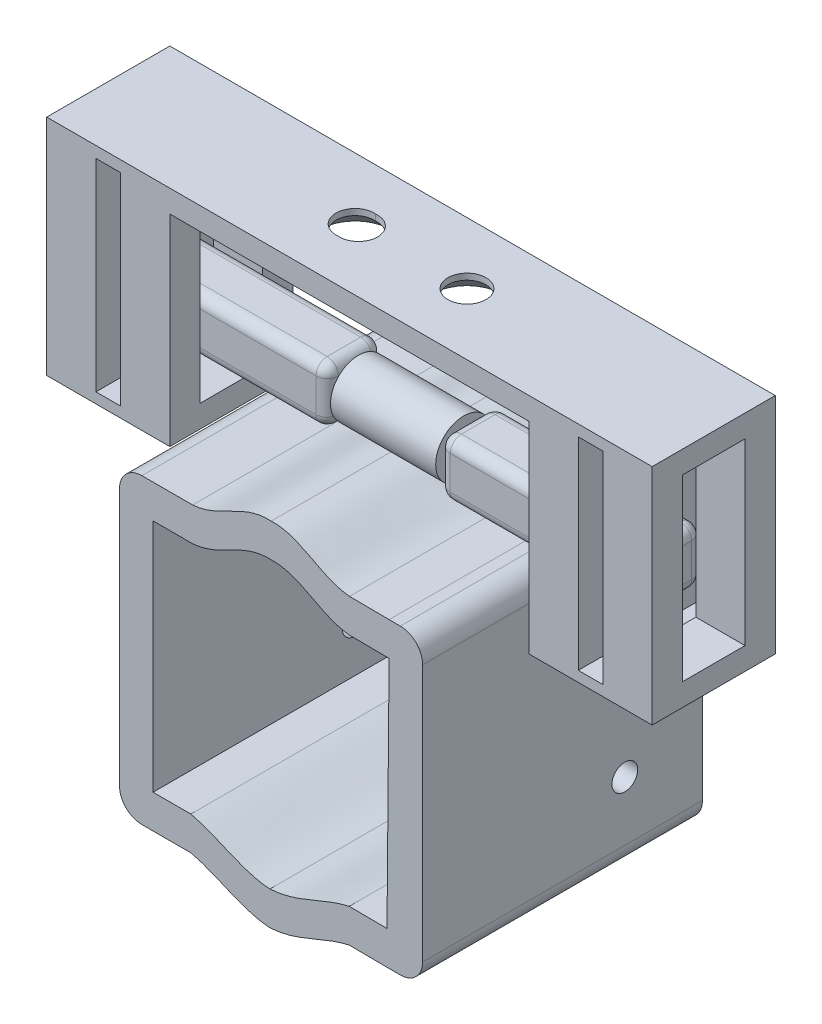
from build123d import *

# Parameters (mm, degrees)
EXTRUDE_1_DEPTH             = 25
CUT_EXTRUDE_1_DEPTH         = 41.095876517
CUT_EXTRUDE_1_DEPTH_BACK    = 41.095876517
SKETCH_2_R                  = 1.15
EXTRUDE_2_DEPTH             = 2.5
EXTRUDE_2_2_DEPTH           = 2.5
SKETCH_5_4_ONE_SIDE_W       = 10
SKETCH_5_4_ONE_SIDE_H       = 1.2
REVOLVE_START               = -4.643273261
REVOLVE_2_OUTLINE_R         = 2.5
REVOLVE_2_OUTLINE_R_2       = 1.5
REVOLVE_2_DEPTH             = 9.4
FILLET_2_R                  = 2
EXTRUDE_4_DEPTH             = 3
EXTRUDE_5_DEPTH             = 8
CUT_EXTRUDE_2_DEPTH         = 64.532099048
CUT_EXTRUDE_2_DEPTH_BACK    = 64.532099048
SKETCH_8_W                  = 5.6
SKETCH_8_H                  = 16
CUT_EXTRUDE_3_DEPTH         = 47.413569012
CUT_EXTRUDE_3_DEPTH_BACK    = 47.413569012
SKETCH_9_W                  = 2.2
SKETCH_9_H                  = 18.065509992
CUT_EXTRUDE_4_DEPTH         = 46.334527546
CUT_EXTRUDE_4_DEPTH_BACK    = 46.334527546
SKETCH_10_R                 = 1.1
EXTRUDE_6_REACH             = 63.183
FILLET_3_R                  = 1
HOLE_WIZARD_M3_1_AT_2_COUNT = 2
HOLE_WIZARD_M3_1_AT_2_PITCH = 10
HOLE_WIZARD_M3_1_AT_3_COUNT = 2
HOLE_WIZARD_M3_1_AT_3_PITCH = 0.306726739


# Read off the part's stored shape, not the designer's step: 旋转2
with BuildPart() as part:
    # 草图1 → 凸台-拉伸1 (new body)
    with BuildSketch(Plane.XY):
        with BuildLine():
            Line((7.052697147, 13.436823414), (10.592794585, 13.405158827))
            Line((10.592794585, 13.405158827), (13.592794585, 13.405158827))
            Line((13.592794585, 13.405158827), (13.592794585, -13.592980697))
            Line((13.592794585, -13.592980697), (10.404975627, -13.592980697))
            Line((10.404975627, -13.592980697), (7.029904788, -13.562792199))
            add(Edge.make_bspline(
                [(7.029904788, -13.562792199), (4.597333526, -14.096242424), (2.501456168, -15.632148645), (-0.057443029, -15.766813933)],
                knots=[0, 0, 0, 0, 1, 1, 1, 1], degree=3))
            add(Edge.make_bspline(
                [(-7.124794153, -13.499489743), (-4.697091476, -14.05467602), (-2.615035398, -15.60926674), (-0.057443029, -15.766813933)],
                knots=[0, 0, 0, 0, 1, 1, 1, 1], degree=3))
            Line((-7.124794153, -13.499489743), (-10.5, -13.499489743))
            Line((-10.5, -13.499489743), (-13.5, -13.499489743))
            Line((-13.5, -13.499489743), (-13.5, -10.499489743))
            Line((-13.5, -10.499489743), (-13.5, 10.499489743))
            Line((-13.5, 10.499489743), (-13.5, 13.499489743))
            Line((-13.5, 13.499489743), (-10.5, 13.499489743))
            Line((-10.5, 13.499489743), (-6.959760952, 13.499489743))
            add(Edge.make_bspline(
                [(-6.959760952, 13.499489743), (-4.398436956, 13.674500845), (-2.600498048, 15.908759419), (0.056726739, 15.762032629)],
                knots=[0, 0, 0, 0, 1, 1, 1, 1], degree=3))
            add(Edge.make_bspline(
                [(7.052697147, 13.436823414), (4.493040937, 13.634736496), (2.71515759, 15.884986815), (0.056726739, 15.762032629)],
                knots=[0, 0, 0, 0, 1, 1, 1, 1], degree=3))
        make_face()
        with BuildLine():
            Line((-6.959760952, 10.499489743), (-10.5, 10.499489743))
            Line((-10.5, 10.499489743), (-10.5, -10.499489743))
            Line((-10.5, -10.499489743), (-7.124794153, -10.499489743))
            add(Edge.make_bspline(
                [(-7.124794153, -10.499489743), (-4.697091476, -11.05467602), (-2.615035398, -12.60926674), (-0.057443029, -12.766813933)],
                knots=[0, 0, 0, 0, 1, 1, 1, 1], degree=3))
            add(Edge.make_bspline(
                [(7.029904788, -10.562792199), (4.597333526, -11.096242424), (2.501456168, -12.632148645), (-0.057443029, -12.766813933)],
                knots=[0, 0, 0, 0, 1, 1, 1, 1], degree=3))
            Line((7.029904788, -10.562792199), (10.404975627, -10.592980697))
            Line((10.404975627, -10.592980697), (10.592794585, 10.405158827))
            Line((10.592794585, 10.405158827), (7.052697147, 10.436823414))
            add(Edge.make_bspline(
                [(7.052697147, 10.436823414), (4.493040937, 10.634736496), (2.71515759, 12.884986815), (0.056726739, 12.762032629)],
                knots=[0, 0, 0, 0, 1, 1, 1, 1], degree=3))
            add(Edge.make_bspline(
                [(-6.959760952, 10.499489743), (-4.398436956, 10.674500845), (-2.600498048, 12.908759419), (0.056726739, 12.762032629)],
                knots=[0, 0, 0, 0, 1, 1, 1, 1], degree=3))
        make_face(mode=Mode.SUBTRACT)
    extrude(amount=EXTRUDE_1_DEPTH)

    # 草图2 → 切除-拉伸1 (cut, two sides: drawn at the far end of the back side and taken through both)
    with BuildSketch(Plane(origin=(13.592794585, 0, 0), x_dir=(0, 0, -1), z_dir=(1, 0, 0)).offset(-CUT_EXTRUDE_1_DEPTH_BACK)):
        with Locations(Location((-6.94, 9.695158827, 0), (0, 0, 38.125882952))):
            Circle(SKETCH_2_R)
        with Locations(Location((-6.94, -6.304841173, 0), (0, 0, 90))):
            Circle(SKETCH_2_R)
    extrude(amount=CUT_EXTRUDE_1_DEPTH + CUT_EXTRUDE_1_DEPTH_BACK, mode=Mode.SUBTRACT)

    # 圆角2
    fillet_2_edges = [part.edges().sort_by_distance(p)[0] for p in [
        (13.592794585, 13.405158827, 12.5),
        (13.592794585, -13.592980697, 12.5),
        (-13.5, -13.499489743, 12.5),
        (-13.5, 13.499489743, 12.5),
    ]]
    fillet(fillet_2_edges, radius=FILLET_2_R)


with BuildPart() as body_2:
    # 草图5 → 凸台-拉伸2 (new, symmetric)
    with BuildSketch(Plane(origin=(0, 17.499489743, 0), x_dir=(1, 0, 0), z_dir=(0, 1, 0))):
        Polygon((5.056726739, -14), (5.056726739, -15), (23.613453479, -15), (23.613453479, -10), (5.056726739, -10), (5.056726739, -11), (5.056726739, -11.3), (5.056726739, -12.5), align=None)
    extrude(amount=EXTRUDE_2_DEPTH, both=True)



with BuildPart() as body_3:
    # 草图5 → Extrude 2 2 (new, symmetric)
    with BuildSketch(Plane(origin=(0, 17.499489743, 0), x_dir=(1, 0, 0), z_dir=(0, 1, 0))):
        Polygon((-4.943273261, -10), (-23.5, -10), (-23.5, -15), (-4.943273261, -15), (-4.943273261, -14), (-4.943273261, -12.5), (-4.943273261, -11.3), (-4.943273261, -11), align=None)
    extrude(amount=EXTRUDE_2_2_DEPTH, both=True)


with BuildPart() as body_2_1:
    add(body_2.part)

    add(body_3.part)  # 旋转1 merges body 3
    # 草图5<4> one side → 旋转1 (revolve)
    with BuildSketch(Plane(origin=(0, 17.499489743, 0), x_dir=(1, 0, 0), z_dir=(0, 1, 0)), mode=Mode.PRIVATE) as revolve_1_sk:
        with Locations((0.056726739, -11.9)):
            Rectangle(SKETCH_5_4_ONE_SIDE_W, SKETCH_5_4_ONE_SIDE_H)
    revolve(revolve_1_sk.sketch.rotate(Axis((-4.943273261, 17.499489743, 12.5), (1, 0, 0)), 180), axis=Axis((-4.943273261, 17.499489743, 12.5), (1, 0, 0)))

    # 草图10 → 切除-拉伸4 (cut, two sides: drawn at the far end of the back side and taken through both)
    with BuildSketch(Plane(origin=(0, 0, 10), x_dir=(-1, 0, 0), z_dir=(0, 0, -1)).offset(-CUT_EXTRUDE_4_DEPTH_BACK)):
        with Locations((21.5, 17.499489743)):
            Circle(SKETCH_10_R)
        with Locations((-21.613453479, 17.499489743)):
            Circle(SKETCH_10_R)
    extrude(amount=CUT_EXTRUDE_4_DEPTH + CUT_EXTRUDE_4_DEPTH_BACK, mode=Mode.SUBTRACT)

    # 圆角3
    # the kernel refuses this fillet: 1 mm, written as the material it takes off along each edge
    with BuildSketch(Plane(origin=(-5.943273261, 18.999489743, 11), x_dir=(1, 0, 0), z_dir=(0, 0, -1))) as fillet_3_piece_1_section:
        Polygon((0, 0), (FILLET_3_R, 0), (FILLET_3_R, -FILLET_3_R), (0, -FILLET_3_R), align=None)
    fillet_3_piece_1 = extrude(amount=FILLET_3_R, mode=Mode.PRIVATE)
    fillet_3_piece_1 = fillet_3_piece_1 - Plane(origin=(-5.943273261, 18.999489743, 11), x_dir=(-0.7071067811865475, -0.7071067811865475, 0), z_dir=(0, 0, -1)) * Sphere(FILLET_3_R, mode=Mode.PRIVATE)
    add(fillet_3_piece_1, mode=Mode.SUBTRACT)
    with BuildSketch(Plane(origin=(-22.5, 18.999489743, 11), x_dir=(-1, 0, 0), z_dir=(0, 0, -1))) as fillet_3_piece_2_section:
        Polygon((0, 0), (FILLET_3_R, 0), (FILLET_3_R, FILLET_3_R), (0, FILLET_3_R), align=None)
    fillet_3_piece_2 = extrude(amount=FILLET_3_R, mode=Mode.PRIVATE)
    fillet_3_piece_2 = fillet_3_piece_2 - Plane(origin=(-22.5, 18.999489743, 11), x_dir=(0.7071067811865475, -0.7071067811865475, 0), z_dir=(0, 0, -1)) * Sphere(FILLET_3_R, mode=Mode.PRIVATE)
    add(fillet_3_piece_2, mode=Mode.SUBTRACT)
    with BuildSketch(Plane(origin=(-22.5, 18.999489743, 14), x_dir=(0, 1, 0), z_dir=(-1, 0, 0))) as fillet_3_piece_3_section:
        Polygon((0, 0), (FILLET_3_R, 0), (FILLET_3_R, -FILLET_3_R), (0, -FILLET_3_R), align=None)
    fillet_3_piece_3 = extrude(amount=FILLET_3_R, mode=Mode.PRIVATE)
    fillet_3_piece_3 = fillet_3_piece_3 - Plane(origin=(-22.5, 18.999489743, 14), x_dir=(0, -0.7071067811865475, -0.7071067811865475), z_dir=(-1, 0, 0)) * Sphere(FILLET_3_R, mode=Mode.PRIVATE)
    add(fillet_3_piece_3, mode=Mode.SUBTRACT)
    with BuildSketch(Plane(origin=(22.613453479, 18.999489743, 11), x_dir=(0, 0, -1), z_dir=(0, 1, 0))) as fillet_3_piece_4_section:
        Polygon((0, 0), (FILLET_3_R, 0), (FILLET_3_R, -FILLET_3_R), (0, -FILLET_3_R), align=None)
    fillet_3_piece_4 = extrude(amount=FILLET_3_R, mode=Mode.PRIVATE)
    fillet_3_piece_4 = fillet_3_piece_4 - Plane(origin=(22.613453479, 18.999489743, 11), x_dir=(-0.7071067811865475, 0, 0.7071067811865475), z_dir=(0, 1, 0)) * Sphere(FILLET_3_R, mode=Mode.PRIVATE)
    add(fillet_3_piece_4, mode=Mode.SUBTRACT)
    with BuildSketch(Plane(origin=(6.056726739, 18.999489743, 11), x_dir=(0, 1, 0), z_dir=(-1, 0, 0))) as fillet_3_piece_5_section:
        Polygon((0, 0), (FILLET_3_R, 0), (FILLET_3_R, FILLET_3_R), (0, FILLET_3_R), align=None)
    fillet_3_piece_5 = extrude(amount=FILLET_3_R, mode=Mode.PRIVATE)
    fillet_3_piece_5 = fillet_3_piece_5 - Plane(origin=(6.056726739, 18.999489743, 11), x_dir=(0, -0.7071067811865475, 0.7071067811865475), z_dir=(-1, 0, 0)) * Sphere(FILLET_3_R, mode=Mode.PRIVATE)
    add(fillet_3_piece_5, mode=Mode.SUBTRACT)
    with BuildSketch(Plane(origin=(22.613453479, 15.999489743, 11), x_dir=(0, 0, -1), z_dir=(0, -1, 0))) as fillet_3_piece_6_section:
        Polygon((0, 0), (FILLET_3_R, 0), (FILLET_3_R, FILLET_3_R), (0, FILLET_3_R), align=None)
    fillet_3_piece_6 = extrude(amount=FILLET_3_R, mode=Mode.PRIVATE)
    fillet_3_piece_6 = fillet_3_piece_6 - Plane(origin=(22.613453479, 15.999489743, 11), x_dir=(-0.7071067811865475, 0, 0.7071067811865475), z_dir=(0, -1, 0)) * Sphere(FILLET_3_R, mode=Mode.PRIVATE)
    add(fillet_3_piece_6, mode=Mode.SUBTRACT)
    with BuildSketch(Plane(origin=(6.056726739, 15.999489743, 11), x_dir=(0, -1, 0), z_dir=(-1, 0, 0))) as fillet_3_piece_7_section:
        Polygon((0, 0), (FILLET_3_R, 0), (FILLET_3_R, -FILLET_3_R), (0, -FILLET_3_R), align=None)
    fillet_3_piece_7 = extrude(amount=FILLET_3_R, mode=Mode.PRIVATE)
    fillet_3_piece_7 = fillet_3_piece_7 - Plane(origin=(6.056726739, 15.999489743, 11), x_dir=(0, 0.7071067811865475, 0.7071067811865475), z_dir=(-1, 0, 0)) * Sphere(FILLET_3_R, mode=Mode.PRIVATE)
    add(fillet_3_piece_7, mode=Mode.SUBTRACT)
    with BuildSketch(Plane(origin=(6.056726739, 15.999489743, 14), x_dir=(0, 0, 1), z_dir=(-1, 0, 0))) as fillet_3_piece_8_section:
        Polygon((0, 0), (FILLET_3_R, 0), (FILLET_3_R, -FILLET_3_R), (0, -FILLET_3_R), align=None)
    fillet_3_piece_8 = extrude(amount=FILLET_3_R, mode=Mode.PRIVATE)
    fillet_3_piece_8 = fillet_3_piece_8 - Plane(origin=(6.056726739, 15.999489743, 14), x_dir=(0, 0.7071067811865475, -0.7071067811865475), z_dir=(-1, 0, 0)) * Sphere(FILLET_3_R, mode=Mode.PRIVATE)
    add(fillet_3_piece_8, mode=Mode.SUBTRACT)
    with BuildSketch(Plane(origin=(22.613453479, 15.999489743, 14), x_dir=(0, -1, 0), z_dir=(0, 0, 1))) as fillet_3_piece_9_section:
        Polygon((0, 0), (FILLET_3_R, 0), (FILLET_3_R, FILLET_3_R), (0, FILLET_3_R), align=None)
    fillet_3_piece_9 = extrude(amount=FILLET_3_R, mode=Mode.PRIVATE)
    fillet_3_piece_9 = fillet_3_piece_9 - Plane(origin=(22.613453479, 15.999489743, 14), x_dir=(-0.7071067811865475, 0.7071067811865475, 0), z_dir=(0, 0, 1)) * Sphere(FILLET_3_R, mode=Mode.PRIVATE)
    add(fillet_3_piece_9, mode=Mode.SUBTRACT)
    with BuildSketch(Plane(origin=(6.056726739, 18.999489743, 14), x_dir=(0, 0, 1), z_dir=(-1, 0, 0))) as fillet_3_piece_10_section:
        Polygon((0, 0), (FILLET_3_R, 0), (FILLET_3_R, FILLET_3_R), (0, FILLET_3_R), align=None)
    fillet_3_piece_10 = extrude(amount=FILLET_3_R, mode=Mode.PRIVATE)
    fillet_3_piece_10 = fillet_3_piece_10 - Plane(origin=(6.056726739, 18.999489743, 14), x_dir=(0, -0.7071067811865475, -0.7071067811865475), z_dir=(-1, 0, 0)) * Sphere(FILLET_3_R, mode=Mode.PRIVATE)
    add(fillet_3_piece_10, mode=Mode.SUBTRACT)
    with BuildSketch(Plane(origin=(22.613453479, 18.999489743, 14), x_dir=(0, 1, 0), z_dir=(0, 0, 1))) as fillet_3_piece_11_section:
        Polygon((0, 0), (FILLET_3_R, 0), (FILLET_3_R, -FILLET_3_R), (0, -FILLET_3_R), align=None)
    fillet_3_piece_11 = extrude(amount=FILLET_3_R, mode=Mode.PRIVATE)
    fillet_3_piece_11 = fillet_3_piece_11 - Plane(origin=(22.613453479, 18.999489743, 14), x_dir=(-0.7071067811865475, -0.7071067811865475, 0), z_dir=(0, 0, 1)) * Sphere(FILLET_3_R, mode=Mode.PRIVATE)
    add(fillet_3_piece_11, mode=Mode.SUBTRACT)
    with BuildSketch(Plane(origin=(-5.943273261, 18.999489743, 14), x_dir=(0, 1, 0), z_dir=(1, 0, 0))) as fillet_3_piece_12_section:
        Polygon((0, 0), (FILLET_3_R, 0), (FILLET_3_R, FILLET_3_R), (0, FILLET_3_R), align=None)
    fillet_3_piece_12 = extrude(amount=FILLET_3_R, mode=Mode.PRIVATE)
    fillet_3_piece_12 = fillet_3_piece_12 - Plane(origin=(-5.943273261, 18.999489743, 14), x_dir=(0, -0.7071067811865475, -0.7071067811865475), z_dir=(1, 0, 0)) * Sphere(FILLET_3_R, mode=Mode.PRIVATE)
    add(fillet_3_piece_12, mode=Mode.SUBTRACT)
    with BuildSketch(Plane(origin=(-22.5, 15.999489743, 14), x_dir=(-1, 0, 0), z_dir=(0, -1, 0))) as fillet_3_piece_13_section:
        Polygon((0, 0), (FILLET_3_R, 0), (FILLET_3_R, -FILLET_3_R), (0, -FILLET_3_R), align=None)
    fillet_3_piece_13 = extrude(amount=FILLET_3_R, mode=Mode.PRIVATE)
    fillet_3_piece_13 = fillet_3_piece_13 - Plane(origin=(-22.5, 15.999489743, 14), x_dir=(0.7071067811865475, 0, -0.7071067811865475), z_dir=(0, -1, 0)) * Sphere(FILLET_3_R, mode=Mode.PRIVATE)
    add(fillet_3_piece_13, mode=Mode.SUBTRACT)
    with BuildSketch(Plane(origin=(-5.943273261, 15.999489743, 14), x_dir=(1, 0, 0), z_dir=(0, -1, 0))) as fillet_3_piece_14_section:
        Polygon((0, 0), (FILLET_3_R, 0), (FILLET_3_R, FILLET_3_R), (0, FILLET_3_R), align=None)
    fillet_3_piece_14 = extrude(amount=FILLET_3_R, mode=Mode.PRIVATE)
    fillet_3_piece_14 = fillet_3_piece_14 - Plane(origin=(-5.943273261, 15.999489743, 14), x_dir=(-0.7071067811865475, 0, -0.7071067811865475), z_dir=(0, -1, 0)) * Sphere(FILLET_3_R, mode=Mode.PRIVATE)
    add(fillet_3_piece_14, mode=Mode.SUBTRACT)
    with BuildSketch(Plane(origin=(-22.5, 15.999489743, 11), x_dir=(0, -1, 0), z_dir=(0, 0, -1))) as fillet_3_piece_15_section:
        Polygon((0, 0), (FILLET_3_R, 0), (FILLET_3_R, FILLET_3_R), (0, FILLET_3_R), align=None)
    fillet_3_piece_15 = extrude(amount=FILLET_3_R, mode=Mode.PRIVATE)
    fillet_3_piece_15 = fillet_3_piece_15 - Plane(origin=(-22.5, 15.999489743, 11), x_dir=(0.7071067811865475, 0.7071067811865475, 0), z_dir=(0, 0, -1)) * Sphere(FILLET_3_R, mode=Mode.PRIVATE)
    add(fillet_3_piece_15, mode=Mode.SUBTRACT)
    with BuildSketch(Plane(origin=(-5.943273261, 15.999489743, 11), x_dir=(0, -1, 0), z_dir=(0, 0, -1))) as fillet_3_piece_16_section:
        Polygon((0, 0), (FILLET_3_R, 0), (FILLET_3_R, -FILLET_3_R), (0, -FILLET_3_R), align=None)
    fillet_3_piece_16 = extrude(amount=FILLET_3_R, mode=Mode.PRIVATE)
    fillet_3_piece_16 = fillet_3_piece_16 - Plane(origin=(-5.943273261, 15.999489743, 11), x_dir=(-0.7071067811865475, 0.7071067811865475, 0), z_dir=(0, 0, -1)) * Sphere(FILLET_3_R, mode=Mode.PRIVATE)
    add(fillet_3_piece_16, mode=Mode.SUBTRACT)
    with BuildSketch(Plane(origin=(-5.943273261, 19.999489743, 10), x_dir=(0, -1, 0), z_dir=(-1, 0, 0)), Plane(origin=(6.056726739, 19.999489743, 15), x_dir=(0, -1, 0), z_dir=(1, 0, 0)), Plane(origin=(22.613453479, 14.999489743, 10), x_dir=(0, 0, 1), z_dir=(-1, 0, 0)), Plane(origin=(-22.5, 14.999489743, 15), x_dir=(0, 0, -1), z_dir=(1, 0, 0))) as fillet_3_piece_17:
        with BuildLine():
            CenterArc((FILLET_3_R, FILLET_3_R), FILLET_3_R, 180, 90)
            Line((0, FILLET_3_R), (0, 0))
            Line((0, 0), (FILLET_3_R, 0))
        make_face()
    extrude(amount=16.556726739, mode=Mode.SUBTRACT)
    with BuildSketch(Plane(origin=(-23.5, 19.999489743, 11), x_dir=(0, -1, 0), z_dir=(0, 0, 1)), Plane(origin=(23.613453479, 15.999489743, 10), x_dir=(-1, 0, 0), z_dir=(0, 1, 0)), Plane(origin=(23.613453479, 14.999489743, 14), x_dir=(-1, 0, 0), z_dir=(0, 0, -1)), Plane(origin=(-23.5, 14.999489743, 11), x_dir=(1, 0, 0), z_dir=(0, 0, 1)), Plane(origin=(-4.943273261, 14.999489743, 14), x_dir=(-1, 0, 0), z_dir=(0, 0, -1))) as fillet_3_piece_18:
        with BuildLine():
            CenterArc((FILLET_3_R, FILLET_3_R), FILLET_3_R, 180, 90)
            Line((0, FILLET_3_R), (0, 0))
            Line((0, 0), (FILLET_3_R, 0))
        make_face()
    extrude(amount=3, mode=Mode.SUBTRACT)
    with BuildSketch(Plane(origin=(22.613453479, 19.999489743, 10), x_dir=(0, 0, 1), z_dir=(-1, 0, 0)), Plane(origin=(6.056726739, 14.999489743, 15), x_dir=(0, 1, 0), z_dir=(1, 0, 0)), Plane(origin=(-22.5, 19.999489743, 15), x_dir=(0, 0, -1), z_dir=(1, 0, 0)), Plane(origin=(-5.943273261, 14.999489743, 10), x_dir=(0, 1, 0), z_dir=(-1, 0, 0))) as fillet_3_piece_19:
        with BuildLine():
            CenterArc((FILLET_3_R, -FILLET_3_R), FILLET_3_R, 90, 90)
            Line((0, -FILLET_3_R), (0, 0))
            Line((0, 0), (FILLET_3_R, 0))
        make_face()
    extrude(amount=16.556726739, mode=Mode.SUBTRACT)
    with BuildSketch(Plane(origin=(5.056726739, 14.999489743, 11), x_dir=(0, 1, 0), z_dir=(0, 0, 1)), Plane(origin=(5.056726739, 18.999489743, 10), x_dir=(0, 0, 1), z_dir=(0, -1, 0)), Plane(origin=(5.056726739, 15.999489743, 15), x_dir=(0, 0, -1), z_dir=(0, 1, 0)), Plane(origin=(23.613453479, 19.999489743, 14), x_dir=(-1, 0, 0), z_dir=(0, 0, -1)), Plane(origin=(23.613453479, 15.999489743, 15), x_dir=(-1, 0, 0), z_dir=(0, 1, 0)), Plane(origin=(5.056726739, 19.999489743, 14), x_dir=(0, -1, 0), z_dir=(0, 0, -1)), Plane(origin=(-4.943273261, 19.999489743, 11), x_dir=(0, -1, 0), z_dir=(0, 0, 1)), Plane(origin=(-4.943273261, 18.999489743, 15), x_dir=(0, 0, -1), z_dir=(0, -1, 0)), Plane(origin=(-23.5, 15.999489743, 15), x_dir=(0, 0, -1), z_dir=(0, 1, 0)), Plane(origin=(-23.5, 15.999489743, 10), x_dir=(1, 0, 0), z_dir=(0, 1, 0)), Plane(origin=(-4.943273261, 18.999489743, 10), x_dir=(-1, 0, 0), z_dir=(0, -1, 0))) as fillet_3_piece_20:
        with BuildLine():
            CenterArc((FILLET_3_R, -FILLET_3_R), FILLET_3_R, 90, 90)
            Line((0, -FILLET_3_R), (0, 0))
            Line((0, 0), (FILLET_3_R, 0))
        make_face()
    extrude(amount=3, mode=Mode.SUBTRACT)


with BuildPart() as body_3_2:
    # 旋转2 outline → 旋转2 (new body)
    with BuildSketch(Plane.YZ.offset(REVOLVE_START)):
        with Locations((17.499489743, 12.5)):
            Circle(REVOLVE_2_OUTLINE_R)
        with Locations((17.499489743, 12.5)):
            Circle(REVOLVE_2_OUTLINE_R_2, mode=Mode.SUBTRACT)
    extrude(amount=REVOLVE_2_DEPTH)


with BuildPart() as body_4:
    # 草图6 → 凸台-拉伸4 (new body)
    with BuildSketch(Plane.XY.offset(15)):
        Polygon((-30.5, 29.999489743), (-30.5, 9.999489743), (-26.5, 9.999489743), (-26.5, 14.999489743), (-26.5, 29.999489743), align=None)
        Polygon((-26.5, 9.999489743), (-26.5, 14.999489743), (-26.5, 29.999489743), (-23.5, 29.999489743), (-23.5, 19.999489743), (-23.5, 9.999489743), align=None)
        Polygon((-19.5, 9.999489743), (-23.5, 9.999489743), (-23.5, 19.999489743), (-23.5, 29.999489743), (-19.5, 29.999489743), align=None)
    extrude(amount=EXTRUDE_4_DEPTH)

    # 草图6<2> → 凸台-拉伸5 (add)
    with BuildSketch(Plane.XY.offset(15)):
        Polygon((-30.5, 29.999489743), (-30.5, 9.999489743), (-26.5, 9.999489743), (-26.5, 14.999489743), (-26.5, 29.999489743), align=None)
        Polygon((-26.5, 9.999489743), (-26.5, 14.999489743), (-26.5, 29.999489743), (-23.5, 29.999489743), (-23.5, 19.999489743), (-23.5, 9.999489743), align=None)
        Polygon((-19.5, 9.999489743), (-23.5, 9.999489743), (-23.5, 19.999489743), (-23.5, 29.999489743), (-19.5, 29.999489743), align=None)
    extrude(amount=-EXTRUDE_5_DEPTH)

    # 草图8 → 切除-拉伸2 (cut, two sides: drawn at the far end of the back side and taken through both)
    with BuildSketch(Plane.ZY.offset(26.5).offset(-CUT_EXTRUDE_2_DEPTH_BACK)):
        with Locations((12.5, 19.999489743)):
            Rectangle(SKETCH_8_W, SKETCH_8_H)
    extrude(amount=CUT_EXTRUDE_2_DEPTH + CUT_EXTRUDE_2_DEPTH_BACK, mode=Mode.SUBTRACT)

    # 草图9 → 切除-拉伸3 (cut, two sides: drawn at the far end of the back side and taken through both)
    with BuildSketch(Plane.XY.offset(18).offset(-CUT_EXTRUDE_3_DEPTH_BACK)):
        with Locations((-25, 19.966734747)):
            Rectangle(SKETCH_9_W, SKETCH_9_H)
    extrude(amount=CUT_EXTRUDE_3_DEPTH + CUT_EXTRUDE_3_DEPTH_BACK, mode=Mode.SUBTRACT)


with BuildPart() as body_4_1:
    # Move Body 1: moved
    add(body_4.part.moved(Location((3.5, 0, 0))))


with BuildPart() as body_5:
    # Move Body 2: copy of body 4
    add(body_4_1.part.moved(Location((43.1, 0, 0))))


with BuildPart() as body_4_2:
    add(body_4_1.part)

    # 草图11 → 凸台-拉伸6 (add, up to next)
    with BuildSketch(Plane.ZY.offset(-20.1), mode=Mode.PRIVATE) as extrude_6_sk1:
        Polygon((9.8, 27.999489743), (7, 27.999489743), (7, 29.999489743), (18, 29.999489743), (18, 27.999489743), (15.2, 27.999489743), align=None)
    extrude_6_tool1 = extrude(extrude_6_sk1.sketch, amount=EXTRUDE_6_REACH, mode=Mode.PRIVATE) - body_4_2.part

    add(body_5.part)  # 凸台-拉伸6 merges body 5
    add(extrude_6_tool1.solids().sort_by_distance((20.1, 28.99949, 12.5))[0])

    # 草图14 → M3 平头机械螺钉的锥形沉头孔1 (revolve, cut)
    with BuildSketch(Plane(origin=(-4.95, 27.999489743, 12.5), x_dir=(0, 0, -1), z_dir=(1, 0, 0))):
        Polygon((0, 0), (0, 6.221463052), (1.7, 5.2), (1.7, 1.45), (3.15, 0), align=None)
    hole_wizard_m3_1 = revolve(axis=Axis((-4.95, 21.649489743, 12.5), (0, 1, 0)), mode=Mode.SUBTRACT)

    # M3 平头机械螺钉的锥形沉头孔1 at 2: M3 平头机械螺钉的锥形沉头孔1 ×2
    with Locations(*[(i * HOLE_WIZARD_M3_1_AT_2_PITCH, 0, 0) for i in range(1, HOLE_WIZARD_M3_1_AT_2_COUNT)]):
        add(hole_wizard_m3_1, mode=Mode.SUBTRACT)

    # M3 平头机械螺钉的锥形沉头孔1 at 3: M3 平头机械螺钉的锥形沉头孔1 ×2
    with Locations(*[(i * HOLE_WIZARD_M3_1_AT_3_PITCH, 0, 0) for i in range(1, HOLE_WIZARD_M3_1_AT_3_COUNT)]):
        add(hole_wizard_m3_1, mode=Mode.SUBTRACT)


solid = Compound([part.part, body_2_1.part, body_3_2.part, body_4_2.part])
